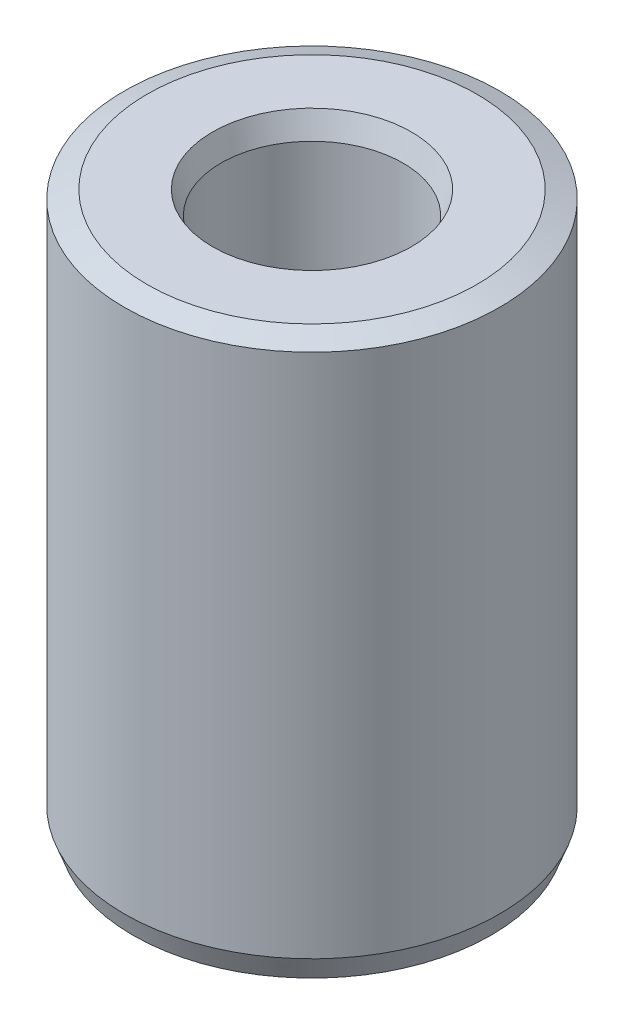
from build123d import *
from OCP.BRepFilletAPI import BRepFilletAPI_MakeChamfer

# Parameters (mm, degrees)
SKETCH1_R           = 50
BOSS_EXTRUDE1_DEPTH = 148.334228354
SKETCH2_R           = 24.257762058
CUT_EXTRUDE1_DEPTH  = 165.326027461
CHAMFER1_SIZE       = 2.257176761
CHAMFER1_SIZE2      = 6.045574789


with BuildPart() as part:
    # Sketch1 → Boss-Extrude1 (new body)
    with BuildSketch(Plane(origin=(0, 0, 0), x_dir=(1, 0, 0), z_dir=(0, 1, 0))):
        Circle(SKETCH1_R)
    extrude(amount=BOSS_EXTRUDE1_DEPTH)

    # Sketch2 → Cut-Extrude1 (cut, through all)
    with BuildSketch(Plane(origin=(0, 0, 0), x_dir=(1, 0, 0), z_dir=(0, 1, 0))):
        Circle(SKETCH2_R)
    extrude(amount=CUT_EXTRUDE1_DEPTH, mode=Mode.SUBTRACT)

    # Chamfer1: one chamfer whose edges measure the first distance from different faces: ONE call of the kernel's chamfer builder (chamfer() names one face for all edges)
    chamfer1_edges_1 = [part.edges().sort_by_distance(p)[0] for p in [
        (-24.257762058, 148.334228354, 0),
    ]]
    chamfer1_side_1 = [part.faces().sort_by_distance(p)[0] for p in [
        (-48.585786438, 148.334228354, 0),
    ]]
    chamfer1_edges_2 = [part.edges().sort_by_distance(p)[0] for p in [
        (-24.257762058, 0, 0),
    ]]
    chamfer1_side_2 = [part.faces().sort_by_distance(p)[0] for p in [
        (-24.257762058, 74.167114177, 0),
    ]]
    chamfer1_edges_3 = [part.edges().sort_by_distance(p)[0] for p in [
        (-50, 0, 0),
    ]]
    chamfer1_side_3 = [part.faces().sort_by_distance(p)[0] for p in [
        (-48.585786438, 0, 0),
    ]]
    chamfer1_edges_4 = [part.edges().sort_by_distance(p)[0] for p in [
        (-50, 148.334228354, 0),
    ]]
    chamfer1_side_4 = [part.faces().sort_by_distance(p)[0] for p in [
        (-50, 74.167114177, 0),
    ]]
    chamfer1 = BRepFilletAPI_MakeChamfer(part.part.solid().wrapped)
    for e in chamfer1_edges_1:
        chamfer1.Add(CHAMFER1_SIZE, CHAMFER1_SIZE2, e.wrapped, chamfer1_side_1[0].wrapped)  # the first distance lies on this face
    for e in chamfer1_edges_2:
        chamfer1.Add(CHAMFER1_SIZE, CHAMFER1_SIZE2, e.wrapped, chamfer1_side_2[0].wrapped)  # the first distance lies on this face
    for e in chamfer1_edges_3:
        chamfer1.Add(CHAMFER1_SIZE, CHAMFER1_SIZE2, e.wrapped, chamfer1_side_3[0].wrapped)  # the first distance lies on this face
    for e in chamfer1_edges_4:
        chamfer1.Add(CHAMFER1_SIZE, CHAMFER1_SIZE2, e.wrapped, chamfer1_side_4[0].wrapped)  # the first distance lies on this face
    add(Compound.cast(chamfer1.Shape()), mode=Mode.REPLACE)


solid = part.part
